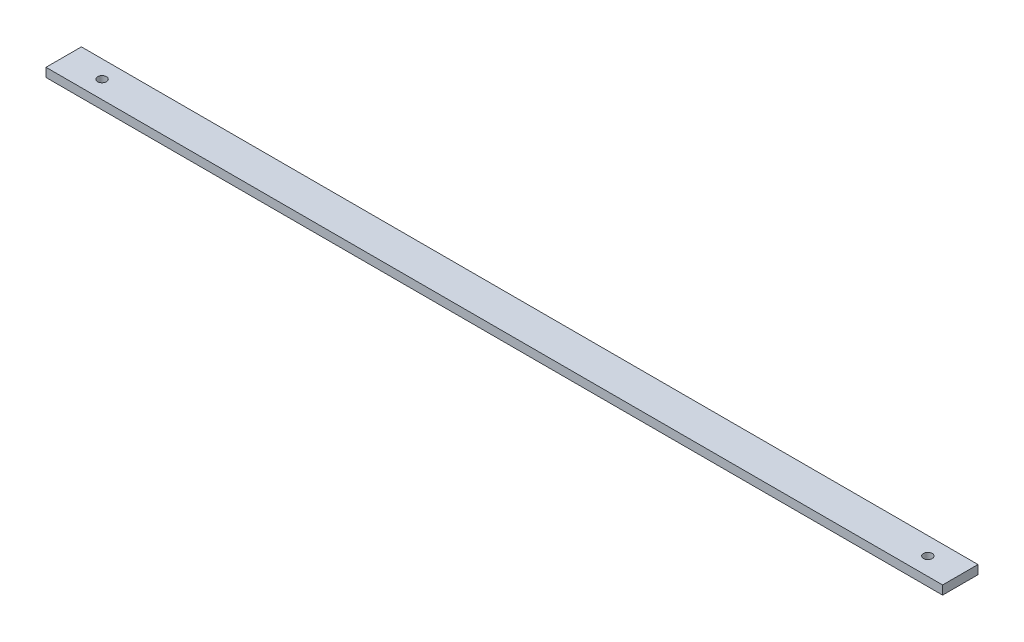
from build123d import *

# Parameters (mm, degrees)
SKETCH1_W           = 304
SKETCH1_H           = 12
SKETCH1_R           = 1.5
BOSS_EXTRUDE1_DEPTH = 3


with BuildPart() as part:
    # Sketch1 → Boss-Extrude1 (new body)
    with BuildSketch(Plane(origin=(0, 3, 0), x_dir=(1, 0, 0), z_dir=(0, 1, 0))):
        Rectangle(SKETCH1_W, SKETCH1_H)
        with Locations((-139, 0)):
            Circle(SKETCH1_R, mode=Mode.SUBTRACT)
        with Locations((141, 0)):
            Circle(SKETCH1_R, mode=Mode.SUBTRACT)
    extrude(amount=-BOSS_EXTRUDE1_DEPTH)


solid = part.part
